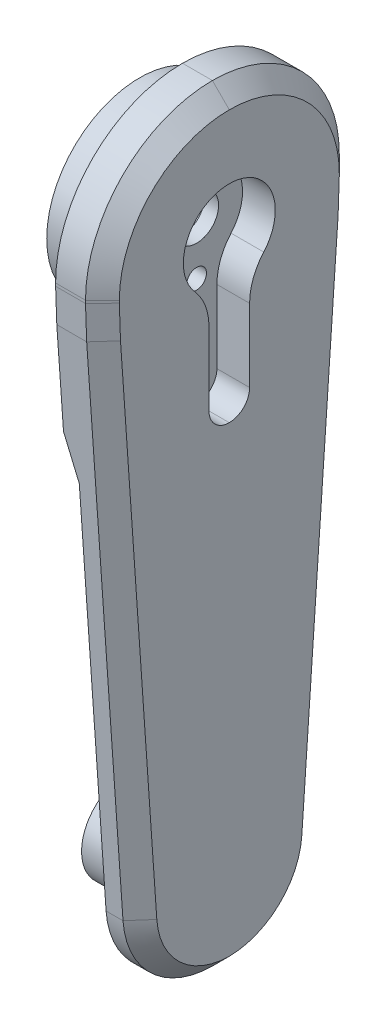
from build123d import *
from OCP.BRepFilletAPI import BRepFilletAPI_MakeChamfer

# Parameters (mm, degrees)
SKETCH1_W           = 20
SKETCH1_H           = 20
BOSS_EXTRUDE1_DEPTH = 20
SKETCH2_W           = 45
SKETCH2_H           = 70
BOSS_EXTRUDE2_DEPTH = 8.3
CUT_EXTRUDE1_DEPTH  = 5.8
FILLET1_R           = 3.6
FILLET2_R           = 10
SKETCH5_R           = 3.9
CUT_EXTRUDE2_DEPTH  = 51.320373608
CUT_EXTRUDE3_REACH  = 49.302
SKETCH6_R           = 1.75
SKETCH13_W          = 20
SKETCH13_H          = 20
CUT_EXTRUDE9_DEPTH  = 20
SKETCH14_R          = 16.475
BOSS_EXTRUDE3_DEPTH = 7.6
SKETCH15_W          = 8.3
SKETCH15_H          = 45
CUT_EXTRUDE10_DEPTH = 12.5
SKETCH16_R          = 13.475
CUT_EXTRUDE11_DEPTH = 7.6
SKETCH18_W          = 8.3
SKETCH18_H          = 45
BOSS_EXTRUDE4_DEPTH = 78.5
FILLET5_R           = 22.5
SKETCH20_W          = 45
SKETCH20_H          = 80
CUT_EXTRUDE12_DEPTH = 2.3
SKETCH21_R          = 8
BOSS_EXTRUDE5_DEPTH = 12.2
CHAMFER1_SIZE       = 3.249196962
CHAMFER1_SIZE_2     = 10
CHAMFER2_SIZE       = 110
CHAMFER2_SIZE2      = 7.691949314
CHAMFER3_SIZE       = 3
FILLET6_R           = 16
CHAMFER4_SIZE       = 3
SKETCH23_R          = 2.35
CUT_EXTRUDE13_DEPTH = 8
CHAMFER5_SIZE       = 1
SKETCH24_R          = 5
BOSS_EXTRUDE6_DEPTH = 7.6
FILLET8_R           = 2
FILLET9_R           = 1.5
SKETCH27_R          = 2.35
CUT_EXTRUDE14_DEPTH = 8
CHAMFER6_SIZE       = 1


# Some blends are built 0.0001 mm under size
with BuildPart() as part:
    # Sketch1 → Boss-Extrude1 (new body)
    with BuildSketch(Plane(origin=(0, 0, 0), x_dir=(0, 0, -1), z_dir=(1, 0, 0))):
        Rectangle(SKETCH1_W, SKETCH1_H)
    extrude(amount=BOSS_EXTRUDE1_DEPTH)

    # Sketch2 → Boss-Extrude2 (add)
    with BuildSketch(Plane(origin=(20, 0, 0), x_dir=(0, 0, -1), z_dir=(1, 0, 0))):
        Rectangle(SKETCH2_W, SKETCH2_H)
    extrude(amount=BOSS_EXTRUDE2_DEPTH)

    # Sketch4 → Cut-Extrude1 (cut)
    with BuildSketch(Plane(origin=(28.3, 0, 0), x_dir=(0, 0, -1), z_dir=(1, 0, 0))):
        with BuildLine():
            Line((3.6, -28.55), (-3.6, -28.55))
            Line((-3.6, -28.55), (-3.6, -7.311805523))
            ThreePointArc((-3.6, -7.311805523), (0, 8.15), (3.6, -7.311805523))
            Line((3.6, -7.311805523), (3.6, -28.55))
        make_face()
    extrude(amount=-CUT_EXTRUDE1_DEPTH, mode=Mode.SUBTRACT)

    # Fillet1
    fillet1_edges = [part.edges().sort_by_distance(p)[0] for p in [
        (25.4, -28.55, 3.6),
        (25.4, -28.55, -3.6),
    ]]
    fillet(fillet1_edges, radius=FILLET1_R - 0.0001)  # a hair under: the kernel refuses the full size

    # Fillet2
    fillet2_edges = [part.edges().sort_by_distance(p)[0] for p in [
        (25.4, -7.311805523, 3.6),
        (25.4, -7.311805523, -3.6),
    ]]
    fillet(fillet2_edges, radius=FILLET2_R)

    # Sketch5 → Cut-Extrude2 (cut, through all)
    with BuildSketch(Plane.ZY):
        Circle(SKETCH5_R)
    extrude(amount=-CUT_EXTRUDE2_DEPTH, mode=Mode.SUBTRACT)

    # Sketch6 → Cut-Extrude3 (cut, up to next)
    with BuildSketch(Plane(origin=(22.5, 0, 0), x_dir=(0, 0, -1), z_dir=(1, 0, 0)), mode=Mode.PRIVATE) as cut_extrude3_sk1:
        with Locations((0, -20.6)):
            Circle(SKETCH6_R)
    cut_extrude3_tool1 = extrude(cut_extrude3_sk1.sketch, amount=-CUT_EXTRUDE3_REACH, mode=Mode.PRIVATE) & part.part
    # Sketch6 → Cut-Extrude3 (cut, up to next)
    with BuildSketch(Plane(origin=(22.5, 0, 0), x_dir=(0, 0, -1), z_dir=(1, 0, 0)), mode=Mode.PRIVATE) as cut_extrude3_sk2:
        with Locations((0, -9.35)):
            Circle(SKETCH6_R)
    cut_extrude3_tool2 = extrude(cut_extrude3_sk2.sketch, amount=-CUT_EXTRUDE3_REACH, mode=Mode.PRIVATE) & part.part
    add(cut_extrude3_tool1.solids().sort_by_distance((22.5, -20.6, 0))[0], mode=Mode.SUBTRACT)
    add(cut_extrude3_tool2.solids().sort_by_distance((22.5, -9.35, 0))[0], mode=Mode.SUBTRACT)

    # Sketch13 → Cut-Extrude9 (cut)
    with BuildSketch(Plane.ZY):
        Rectangle(SKETCH13_W, SKETCH13_H)
    extrude(amount=-CUT_EXTRUDE9_DEPTH, mode=Mode.SUBTRACT)

    # Sketch14 → Boss-Extrude3 (add)
    with BuildSketch(Plane.ZY.offset(-20)):
        with Locations(Location((0, 0, 0), (0, 0, 180))):
            Circle(SKETCH14_R)
    extrude(amount=BOSS_EXTRUDE3_DEPTH)

    # Sketch15 → Cut-Extrude10 (cut)
    with BuildSketch(Plane(origin=(0, 35, 0), x_dir=(1, 0, 0), z_dir=(0, 1, 0))):
        with Locations((24.15, 0)):
            Rectangle(SKETCH15_W, SKETCH15_H)
    extrude(amount=-CUT_EXTRUDE10_DEPTH, mode=Mode.SUBTRACT)

    # Sketch16 → Cut-Extrude11 (cut)
    with BuildSketch(Plane.ZY.offset(-12.4)):
        Circle(SKETCH16_R)
    extrude(amount=-CUT_EXTRUDE11_DEPTH, mode=Mode.SUBTRACT)

    # Sketch18 → Boss-Extrude4 (add)
    with BuildSketch(Plane.XZ.offset(35)):
        with Locations((24.15, 0)):
            Rectangle(SKETCH18_W, SKETCH18_H)
    extrude(amount=BOSS_EXTRUDE4_DEPTH)

    # Fillet5
    fillet5_edges = [part.edges().sort_by_distance(p)[0] for p in [
        (24.15, 22.5, -22.5),
        (24.15, 22.5, 22.5),
    ]]
    fillet(fillet5_edges, radius=FILLET5_R - 0.0001)  # a hair under: the kernel refuses the full size

    # Sketch20 → Cut-Extrude12 (cut)
    with BuildSketch(Plane.ZY.offset(-20)):
        with Locations((0, -73.5)):
            Rectangle(SKETCH20_W, SKETCH20_H)
    extrude(amount=-CUT_EXTRUDE12_DEPTH, mode=Mode.SUBTRACT)

    # Sketch21 → Boss-Extrude5 (add)
    with BuildSketch(Plane.ZY.offset(-22.3)):
        with Locations(Location((0, -99.5, 0), (0, 0, 180))):
            Circle(SKETCH21_R)
    extrude(amount=BOSS_EXTRUDE5_DEPTH)

    # Chamfer1
    # the kernel refuses this chamfer: 10, 3.249196962 mm, written as the material it takes off along each edge
    with BuildSketch(Plane(origin=(20, -33.5, 48.45289629), x_dir=(0.9936991275921845, -0.11208052383233842, 0), z_dir=(0, 0, -1))) as chamfer1_piece_1_section:
        Polygon((CHAMFER1_SIZE * 0.993699127693, -CHAMFER1_SIZE * 0.112080523844), (-CHAMFER1_SIZE_2 * 0.112080523832, -CHAMFER1_SIZE_2 * 0.993699127592), (0, 0), align=None)
    chamfer1_piece_1 = extrude(amount=96.905792579, mode=Mode.PRIVATE)
    chamfer1_piece_1 = split(chamfer1_piece_1, bisect_by=Plane(origin=(22.3, -29.773369579, 0), z_dir=(-1, 0, 0)), keep=Keep.TOP, mode=Mode.PRIVATE)
    add(chamfer1_piece_1, mode=Mode.SUBTRACT)

    # Chamfer2: one chamfer whose edges measure the first distance from different faces: ONE call of the kernel's chamfer builder (chamfer() names one face for all edges)
    chamfer2_edges_1 = [part.edges().sort_by_distance(p)[0] for p in [
        (25.3, -113.5, -22.5),
    ]]
    chamfer2_side_1 = [part.faces().sort_by_distance(p)[0] for p in [
        (24.956924265, -53.138870665, -22.5),
    ]]
    chamfer2_edges_2 = [part.edges().sort_by_distance(p)[0] for p in [
        (25.3, -113.5, 22.5),
    ]]
    chamfer2_side_2 = [part.faces().sort_by_distance(p)[0] for p in [
        (24.956924265, -53.138870665, 22.5),
    ]]
    chamfer2 = BRepFilletAPI_MakeChamfer(part.part.solid().wrapped)
    for e in chamfer2_edges_1:
        chamfer2.Add(CHAMFER2_SIZE, CHAMFER2_SIZE2, e.wrapped, chamfer2_side_1[0].wrapped)  # the first distance lies on this face
    for e in chamfer2_edges_2:
        chamfer2.Add(CHAMFER2_SIZE, CHAMFER2_SIZE2, e.wrapped, chamfer2_side_2[0].wrapped)  # the first distance lies on this face
    add(Compound.cast(chamfer2.Shape()), mode=Mode.REPLACE)

    # Chamfer3
    # the kernel refuses this chamfer: 3 mm, written as the material it takes off along each edge
    with BuildSketch(Plane(origin=(36.099824275, -3.5, -22.5), x_dir=(0, -0.9976567869548854, 0.06841736214481542), z_dir=(-1, 0, 0))) as chamfer3_piece_1:
        Polygon((CHAMFER3_SIZE * 0.99999909909, CHAMFER3_SIZE * 0.00134231857559), (-CHAMFER3_SIZE * 0.997656786955, CHAMFER3_SIZE * 0.0684173621448), (0, 0), align=None)
    extrude(amount=23.89964855, mode=Mode.SUBTRACT)
    with BuildSketch(Plane(origin=(12.200175725, -3.5, 22.5), x_dir=(0, 0.999999099090015, 0.0013423185755924486), z_dir=(1, 0, 0))) as chamfer3_piece_2:
        Polygon((CHAMFER3_SIZE * 0.99999909909, -CHAMFER3_SIZE * 0.00134231857559), (-CHAMFER3_SIZE * 0.997656786955, -CHAMFER3_SIZE * 0.0684173621448), (0, 0), align=None)
    extrude(amount=23.89964855, mode=Mode.SUBTRACT)

    # Fillet6
    # the kernel refuses this fillet: 16 mm, written as the material it takes off along each edge
    with BuildSketch(Plane(origin=(65.600603446, -113.5, -14.808050686), x_dir=(0, 0, 1), z_dir=(-1, 0, 0))) as fillet6_piece_1:
        with BuildLine():
            CenterArc((FILLET6_R * 0.932515086138, FILLET6_R), FILLET6_R, 184, 86)
            Line((-FILLET6_R * 0.0650489641222, FILLET6_R * 0.930243526256), (0, 0))
            Line((0, 0), (FILLET6_R * 0.932515086138, 0))
        make_face()
    extrude(amount=80.601206891, mode=Mode.SUBTRACT)
    with BuildSketch(Plane(origin=(-15.000603446, -113.5, 14.808050686), x_dir=(0, 0.9975640502598242, 0.06975647374412544), z_dir=(1, 0, 0))) as fillet6_piece_2:
        with BuildLine():
            CenterArc((FILLET6_R * 0.932515086138, -FILLET6_R), FILLET6_R, 90, 86)
            Line((-FILLET6_R * 0.0650489641222, -FILLET6_R * 0.930243526256), (0, 0))
            Line((0, 0), (FILLET6_R * 0.932515086138, 0))
        make_face()
    extrude(amount=80.601206891, mode=Mode.SUBTRACT)

    # Chamfer4
    # the kernel refuses this chamfer: 3 mm, written as the material it takes off along each edge
    with BuildSketch(Plane(origin=(28.3, 0.0001, 22.5), x_dir=(0.027495876610587916, 0, -0.9996219169112968), z_dir=(0, -1, 0)), Plane(origin=(28.3, -8.215048964, -22.5), x_dir=(0.027495876610586768, 0, 0.9996219169112968), z_dir=(0, 1, 0))) as chamfer4_piece_1:
        Polygon((CHAMFER4_SIZE * 0.999621916911, -CHAMFER4_SIZE * 0.0274958766106), (-CHAMFER4_SIZE * 0.0274958766106, -CHAMFER4_SIZE * 0.999621916911), (0, 0), align=None)
    extrude(amount=8.215148964, mode=Mode.SUBTRACT)
    with BuildSketch(Plane(origin=(28.3, 0.0001, 0.0001), x_dir=(0, 1, 0), z_dir=(0, 0, -1))) as chamfer4_piece_2:
        Polygon((22.4999 - CHAMFER4_SIZE, 0), (22.4999, -CHAMFER4_SIZE), (22.4999, 0), align=None)
    revolve(axis=Axis((28.3, 0.0001, 0.0001), (1, 0, 0)), revolution_arc=90, mode=Mode.SUBTRACT)
    with BuildSketch(Plane(origin=(28.3, 0.0001, -0.0001), x_dir=(0, 0, -1), z_dir=(0, -1, 0))) as chamfer4_piece_3:
        Polygon((22.4999 - CHAMFER4_SIZE, 0), (22.4999, -CHAMFER4_SIZE), (22.4999, 0), align=None)
    revolve(axis=Axis((28.3, 0.0001, -0.0001), (1, 0, 0)), revolution_arc=90, mode=Mode.SUBTRACT)
    with BuildSketch(Plane(origin=(28.3, 1.203563342, 22.828905189), x_dir=(0.027495876610586778, 0.0697301000010753, -0.9971868881625227), z_dir=(0, -0.9975640502598243, -0.06975647374412554))) as chamfer4_piece_4:
        Polygon((CHAMFER4_SIZE * 0.999621916911, -CHAMFER4_SIZE * 0.0274958766106), (-CHAMFER4_SIZE * 0.0274958766106, -CHAMFER4_SIZE * 0.999621916911), (0, 0), align=None)
    extrude(amount=100.063416375, mode=Mode.SUBTRACT)
    with BuildSketch(Plane(origin=(28.3, 7.210349165, -22.769251326), x_dir=(0.02749587661058679, 0.03488630179317817, 0.9990129742483882), z_dir=(0, -0.9993908270190893, 0.03489949670268572))) as chamfer4_piece_5:
        Polygon((CHAMFER4_SIZE * 0.999621916911, CHAMFER4_SIZE * 0.0274958766106), (-CHAMFER4_SIZE * 0.0274958766106, CHAMFER4_SIZE * 0.999621916911), (0, 0), align=None)
    extrude(amount=21.42644289, mode=Mode.SUBTRACT)
    with BuildSketch(Plane(origin=(28.3, 7.210349164, 22.769251326), x_dir=(0.02749587661058677, 0.034886301793392936, -0.9990129742483806), z_dir=(0, -0.9993908270190818, -0.03489949670290056))) as chamfer4_piece_6:
        Polygon((CHAMFER4_SIZE * 0.999621916911, -CHAMFER4_SIZE * 0.0274958766106), (-CHAMFER4_SIZE * 0.0274958766106, -CHAMFER4_SIZE * 0.999621916911), (0, 0), align=None)
    extrude(amount=21.42644289, mode=Mode.SUBTRACT)
    with BuildSketch(Plane(origin=(28.3, 1.203563342, -22.828905189), x_dir=(0.027495876610586778, 0.06973010000107512, 0.9971868881625227), z_dir=(0, -0.9975640502598243, 0.06975647374412534))) as chamfer4_piece_7:
        Polygon((CHAMFER4_SIZE * 0.999621916911, CHAMFER4_SIZE * 0.0274958766106), (-CHAMFER4_SIZE * 0.0274958766106, CHAMFER4_SIZE * 0.999621916911), (0, 0), align=None)
    extrude(amount=100.063416375, mode=Mode.SUBTRACT)
    with BuildSketch(Plane(origin=(28.3, -97.5, -0.112190692), x_dir=(0, -0.9999754161991546, 0.007011918234514749), z_dir=(0, -0.007011918234514749, -0.9999754161991546))) as chamfer4_piece_8:
        Polygon((16 - CHAMFER4_SIZE, 0), (16, CHAMFER4_SIZE), (16, 0), align=None)
    revolve(axis=Axis((28.3, -97.5, -0.112190692), (-1, 0, 0)), revolution_arc=85.598243387, mode=Mode.SUBTRACT)
    with BuildSketch(Plane(origin=(28.3, -97.5, 0.112190692), x_dir=(0, -0.9999754161989443, -0.0070119182645099615), z_dir=(0, -0.0070119182645099615, 0.9999754161989443))) as chamfer4_piece_9:
        Polygon((16 - CHAMFER4_SIZE, 0), (16, -CHAMFER4_SIZE), (16, 0), align=None)
    revolve(axis=Axis((28.3, -97.5, 0.112190692), (1, 0, 0)), revolution_arc=85.598243385, mode=Mode.SUBTRACT)
    with BuildSketch(Plane(origin=(28.3, 22.5, -0.0001), x_dir=(0.027495876610589064, -0.9996219169112965, 0), z_dir=(0, 0, 1))) as chamfer4_piece_10:
        Polygon((CHAMFER4_SIZE * 0.999621916911, -CHAMFER4_SIZE * 0.0274958766106), (-CHAMFER4_SIZE * 0.0274958766106, -CHAMFER4_SIZE * 0.999621916911), (0, 0), align=None)
    extrude(amount=0.0002, mode=Mode.SUBTRACT)

    # Sketch23 → Cut-Extrude13 (cut)
    with BuildSketch(Plane.ZY.offset(-10.1)):
        with Locations((-4, -99.5)):
            Circle(SKETCH23_R)
        with Locations((4, -99.5)):
            Circle(SKETCH23_R)
    extrude(amount=-CUT_EXTRUDE13_DEPTH, mode=Mode.SUBTRACT)

    # Chamfer5
    chamfer5_edges = [part.edges().sort_by_distance(p)[0] for p in [
        (10.1, -99.5, 1.65),
        (10.1, -99.5, -6.35),
    ]]
    chamfer(chamfer5_edges, length=CHAMFER5_SIZE)

    # Sketch24 → Boss-Extrude6 (add)
    with BuildSketch(Plane.ZY.offset(-20)):
        with Locations((-11.225, 0)):
            Circle(SKETCH24_R)
        with Locations((11.225, 0)):
            Circle(SKETCH24_R)
    extrude(amount=BOSS_EXTRUDE6_DEPTH)

    # Fillet8
    fillet8_edges = [part.edges().sort_by_distance(p)[0] for p in [
        (16.2, -4.810944453, 12.586915367),
        (16.2, 4.810944453, 12.586915367),
        (16.2, 4.810944453, -12.586915367),
        (16.2, -4.810944453, -12.586915367),
    ]]
    fillet(fillet8_edges, radius=FILLET8_R)

    # Fillet9
    fillet9_edges = [part.edges().sort_by_distance(p)[0] for p in [
        (20, 0, 6.225),
        (20, -13.475, 0),
        (20, 13.475, 0),
        (20, 0, -6.225),
        (20, -6.075999698, -11.185646156),
        (20, 6.075999698, -11.185646156),
        (20, 6.075999698, 11.185646156),
        (20, -6.075999698, 11.185646156),
    ]]
    fillet(fillet9_edges, radius=FILLET9_R)

    # Sketch27 → Cut-Extrude14 (cut)
    with BuildSketch(Plane.ZY.offset(-12.4)):
        with Locations((-11.225, 0)):
            Circle(SKETCH27_R)
        with Locations(Location((11.225, 0, 0), (0, 0, 180))):
            Circle(SKETCH27_R)
    extrude(amount=-CUT_EXTRUDE14_DEPTH, mode=Mode.SUBTRACT)

    # Chamfer6
    chamfer6_edges = [part.edges().sort_by_distance(p)[0] for p in [
        (12.4, 0, -13.575),
        (12.4, 0, 13.575),
    ]]
    chamfer(chamfer6_edges, length=CHAMFER6_SIZE)


solid = part.part
